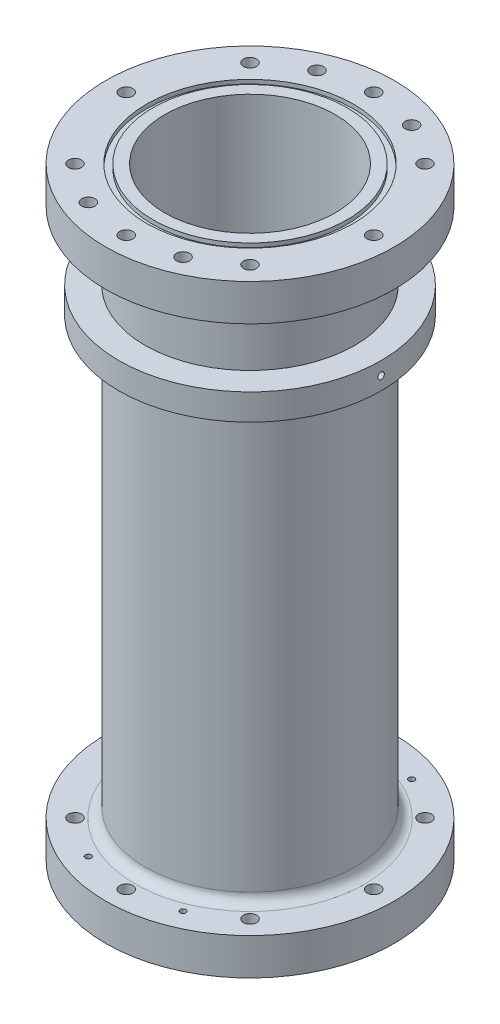
from build123d import *

# Parameters (mm, degrees)
SKETCH2_R               = 50.8
SKETCH2_R_2             = 41.275
BASE_CYLINDER_DEPTH     = 292.1
SKETCH3_R               = 69.85
SKETCH3_R_2             = 41.275
AFT_FLANGE_DEPTH        = 17.78
FORWARD_START           = -17.78
SKETCH4_R               = 69.85
SKETCH4_R_2             = 41.275
FORWARD_FLANGE_DEPTH    = 17.78
SKETCH6_R               = 50.0761
SKETCH6_R_2             = 47.0027
O_RING_SLOT_1_DEPTH     = 1.9812
O_RING_START            = -1.9812
SKETCH7_R               = 50.0761
SKETCH7_R_2             = 47.0027
O_RING_SLOT_2_DEPTH     = 1.9812
CUT_EXTRUDE4_DEPTH      = 309.351187771
CUT_EXTRUDE4_DEPTH_BACK = 309.351187771
SKETCH8_R               = 3.175
FILLET1_R               = 4.7625
SKETCH9_R               = 3.175
CUT_EXTRUDE5_DEPTH      = 7.62
CUT_EXTRUDE6_START      = -7.62
SKETCH10_R              = 3.175
CUT_EXTRUDE6_DEPTH      = 7.62
CUT_EXTRUDE7_REACH      = 303.143
SKETCH11_R              = 1.4097
CUT_EXTRUDE8_REACH      = 303.143
SKETCH12_R              = 1.4097
SKETCH14_R              = 63.5
SKETCH14_R_2            = 50.8
BOSS_EXTRUDE1_DEPTH     = 12.7
SKETCH16_R              = 1.5875
CUT_EXTRUDE10_DEPTH     = 12.7
CUT_EXTRUDE11_START     = -12.7
SKETCH17_R              = 1.5875
CUT_EXTRUDE11_DEPTH     = 12.7


with BuildPart() as part:
    # Sketch2 → Base Cylinder (new body)
    with BuildSketch(Plane(origin=(0, 0, 0), x_dir=(1, 0, 0), z_dir=(0, 1, 0))):
        Circle(SKETCH2_R)
        Circle(SKETCH2_R_2, mode=Mode.SUBTRACT)
    extrude(amount=BASE_CYLINDER_DEPTH)

    # Sketch3 → Aft Flange (add)
    with BuildSketch(Plane.XZ):
        Circle(SKETCH3_R)
        Circle(SKETCH3_R_2, mode=Mode.SUBTRACT)
    extrude(amount=-AFT_FLANGE_DEPTH)

    # Sketch4 → Forward Flange (add)
    with BuildSketch(Plane(origin=(0, 292.1, 0), x_dir=(1, 0, 0), z_dir=(0, 1, 0)).offset(FORWARD_START)):
        Circle(SKETCH4_R)
        Circle(SKETCH4_R_2, mode=Mode.SUBTRACT)
    extrude(amount=FORWARD_FLANGE_DEPTH)

    # Sketch6 → O-Ring Slot 1 (cut)
    with BuildSketch(Plane.XZ):
        Circle(SKETCH6_R)
        Circle(SKETCH6_R_2, mode=Mode.SUBTRACT)
    extrude(amount=-O_RING_SLOT_1_DEPTH, mode=Mode.SUBTRACT)

    # Sketch7 → O-Ring Slot 2 (cut)
    with BuildSketch(Plane(origin=(0, 292.1, 0), x_dir=(1, 0, 0), z_dir=(0, 1, 0)).offset(O_RING_START)):
        Circle(SKETCH7_R)
        Circle(SKETCH7_R_2, mode=Mode.SUBTRACT)
    extrude(amount=O_RING_SLOT_2_DEPTH, mode=Mode.SUBTRACT)

    # Sketch8 → Cut-Extrude4 (cut, two sides: drawn at the far end of the back side and taken through both)
    with BuildSketch(Plane.XZ.offset(-CUT_EXTRUDE4_DEPTH_BACK)):
        with Locations((-59.9186, 0)):
            Circle(SKETCH8_R)
        with Locations((-42.368848379, 42.368848379)):
            Circle(SKETCH8_R)
        with Locations((0, 59.9186)):
            Circle(SKETCH8_R)
        with Locations((42.368848379, 42.368848379)):
            Circle(SKETCH8_R)
        with Locations((59.9186, 0)):
            Circle(SKETCH8_R)
        with Locations((42.368848379, -42.368848379)):
            Circle(SKETCH8_R)
        with Locations((0, -59.9186)):
            Circle(SKETCH8_R)
        with Locations((-42.368848379, -42.368848379)):
            Circle(SKETCH8_R)
    extrude(amount=CUT_EXTRUDE4_DEPTH + CUT_EXTRUDE4_DEPTH_BACK, mode=Mode.SUBTRACT)

    # Fillet1
    fillet1_edges = [part.edges().sort_by_distance(p)[0] for p in [
        (-50.8, 17.78, 0),
        (-50.8, 274.32, 0),
    ]]
    fillet(fillet1_edges, radius=FILLET1_R)

    # Sketch9 → Cut-Extrude5 (cut)
    with BuildSketch(Plane(origin=(0, 292.1, 0), x_dir=(1, 0, 0), z_dir=(0, 1, 0))):
        with Locations((-22.929855511, 55.357568157)):
            Circle(SKETCH9_R)
        with Locations((22.929855511, -55.357568157)):
            Circle(SKETCH9_R)
        with Locations((22.929855511, 55.357568157)):
            Circle(SKETCH9_R)
        with Locations((-22.929855511, -55.357568157)):
            Circle(SKETCH9_R)
    extrude(amount=-CUT_EXTRUDE5_DEPTH, mode=Mode.SUBTRACT)

    # Sketch10 → Cut-Extrude6 (cut)
    with BuildSketch(Plane.XZ.offset(CUT_EXTRUDE6_START)):
        with Locations((-22.929855511, 55.357568157)):
            Circle(SKETCH10_R)
        with Locations((22.929855511, -55.357568157)):
            Circle(SKETCH10_R)
        with Locations((22.929855511, 55.357568157)):
            Circle(SKETCH10_R)
        with Locations((-22.929855511, -55.357568157)):
            Circle(SKETCH10_R)
    extrude(amount=CUT_EXTRUDE6_DEPTH, mode=Mode.SUBTRACT)

    # Sketch11 → Cut-Extrude7 (cut, up to next)
    with BuildSketch(Plane(origin=(0, 284.48, 0), x_dir=(1, 0, 0), z_dir=(0, 1, 0)), mode=Mode.PRIVATE) as cut_extrude7_sk1:
        with Locations((-22.929855511, 55.357568157)):
            Circle(SKETCH11_R)
    cut_extrude7_tool1 = extrude(cut_extrude7_sk1.sketch, amount=-CUT_EXTRUDE7_REACH, mode=Mode.PRIVATE) & part.part
    # Sketch11 → Cut-Extrude7 (cut, up to next)
    with BuildSketch(Plane(origin=(0, 284.48, 0), x_dir=(1, 0, 0), z_dir=(0, 1, 0)), mode=Mode.PRIVATE) as cut_extrude7_sk2:
        with Locations((22.929855511, 55.357568157)):
            Circle(SKETCH11_R)
    cut_extrude7_tool2 = extrude(cut_extrude7_sk2.sketch, amount=-CUT_EXTRUDE7_REACH, mode=Mode.PRIVATE) & part.part
    # Sketch11 → Cut-Extrude7 (cut, up to next)
    with BuildSketch(Plane(origin=(0, 284.48, 0), x_dir=(1, 0, 0), z_dir=(0, 1, 0)), mode=Mode.PRIVATE) as cut_extrude7_sk3:
        with Locations((-22.929855511, -55.357568157)):
            Circle(SKETCH11_R)
    cut_extrude7_tool3 = extrude(cut_extrude7_sk3.sketch, amount=-CUT_EXTRUDE7_REACH, mode=Mode.PRIVATE) & part.part
    # Sketch11 → Cut-Extrude7 (cut, up to next)
    with BuildSketch(Plane(origin=(0, 284.48, 0), x_dir=(1, 0, 0), z_dir=(0, 1, 0)), mode=Mode.PRIVATE) as cut_extrude7_sk4:
        with Locations((22.929855511, -55.357568157)):
            Circle(SKETCH11_R)
    cut_extrude7_tool4 = extrude(cut_extrude7_sk4.sketch, amount=-CUT_EXTRUDE7_REACH, mode=Mode.PRIVATE) & part.part
    add(cut_extrude7_tool1.solids().sort_by_distance((-22.929856, 284.48, -55.357568))[0], mode=Mode.SUBTRACT)
    add(cut_extrude7_tool2.solids().sort_by_distance((22.929856, 284.48, -55.357568))[0], mode=Mode.SUBTRACT)
    add(cut_extrude7_tool3.solids().sort_by_distance((-22.929856, 284.48, 55.357568))[0], mode=Mode.SUBTRACT)
    add(cut_extrude7_tool4.solids().sort_by_distance((22.929856, 284.48, 55.357568))[0], mode=Mode.SUBTRACT)

    # Sketch12 → Cut-Extrude8 (cut, up to next)
    with BuildSketch(Plane.XZ.offset(-7.62), mode=Mode.PRIVATE) as cut_extrude8_sk1:
        with Locations((-22.929855511, 55.357568157)):
            Circle(SKETCH12_R)
    cut_extrude8_tool1 = extrude(cut_extrude8_sk1.sketch, amount=-CUT_EXTRUDE8_REACH, mode=Mode.PRIVATE) & part.part
    # Sketch12 → Cut-Extrude8 (cut, up to next)
    with BuildSketch(Plane.XZ.offset(-7.62), mode=Mode.PRIVATE) as cut_extrude8_sk2:
        with Locations((22.929855511, 55.357568157)):
            Circle(SKETCH12_R)
    cut_extrude8_tool2 = extrude(cut_extrude8_sk2.sketch, amount=-CUT_EXTRUDE8_REACH, mode=Mode.PRIVATE) & part.part
    # Sketch12 → Cut-Extrude8 (cut, up to next)
    with BuildSketch(Plane.XZ.offset(-7.62), mode=Mode.PRIVATE) as cut_extrude8_sk3:
        with Locations((-22.929855511, -55.357568157)):
            Circle(SKETCH12_R)
    cut_extrude8_tool3 = extrude(cut_extrude8_sk3.sketch, amount=-CUT_EXTRUDE8_REACH, mode=Mode.PRIVATE) & part.part
    # Sketch12 → Cut-Extrude8 (cut, up to next)
    with BuildSketch(Plane.XZ.offset(-7.62), mode=Mode.PRIVATE) as cut_extrude8_sk4:
        with Locations((22.929855511, -55.357568157)):
            Circle(SKETCH12_R)
    cut_extrude8_tool4 = extrude(cut_extrude8_sk4.sketch, amount=-CUT_EXTRUDE8_REACH, mode=Mode.PRIVATE) & part.part
    add(cut_extrude8_tool1.solids().sort_by_distance((-22.929856, 7.62, 55.357568))[0], mode=Mode.SUBTRACT)
    add(cut_extrude8_tool2.solids().sort_by_distance((22.929856, 7.62, 55.357568))[0], mode=Mode.SUBTRACT)
    add(cut_extrude8_tool3.solids().sort_by_distance((-22.929856, 7.62, -55.357568))[0], mode=Mode.SUBTRACT)
    add(cut_extrude8_tool4.solids().sort_by_distance((22.929856, 7.62, -55.357568))[0], mode=Mode.SUBTRACT)

    # Sketch14 → Boss-Extrude1 (add)
    with BuildSketch(Plane(origin=(0, 228.6, 0), x_dir=(1, 0, 0), z_dir=(0, 1, 0))):
        Circle(SKETCH14_R)
        Circle(SKETCH14_R_2, mode=Mode.SUBTRACT)
    extrude(amount=BOSS_EXTRUDE1_DEPTH)

    # Sketch16 → Cut-Extrude10 (cut)
    with BuildSketch(Plane(origin=(-63.5, 0, 0), x_dir=(0, 0, -1), z_dir=(1, 0, 0))):
        with Locations((0, 234.95)):
            Circle(SKETCH16_R)
    extrude(amount=CUT_EXTRUDE10_DEPTH, mode=Mode.SUBTRACT)

    # Sketch17 → Cut-Extrude11 (cut)
    with BuildSketch(Plane(origin=(63.5, 0, 0), x_dir=(0, 0, -1), z_dir=(1, 0, 0)).offset(CUT_EXTRUDE11_START)):
        with Locations((0, 234.95)):
            Circle(SKETCH17_R)
    extrude(amount=CUT_EXTRUDE11_DEPTH, mode=Mode.SUBTRACT)


solid = part.part
